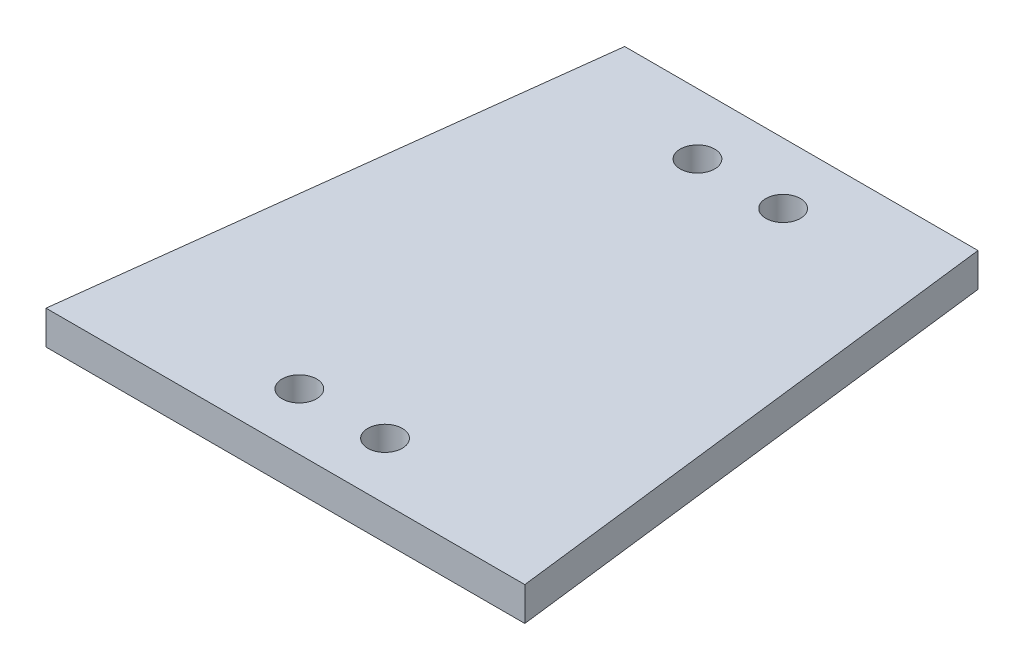
from build123d import *

# Parameters (mm, degrees)
BOSS_EXTRUDE1_DEPTH            = 4
F_4_1_4_1_DIAMETER_HOLE1_D     = 4.1
F_4_1_4_1_DIAMETER_HOLE1_DEPTH = 15


with BuildPart() as part:
    # Sketch1 → Boss-Extrude1 (new body)
    with BuildSketch(Plane(origin=(0, -13.999999791, 0), x_dir=(1, 0, 0), z_dir=(0, 1, 0))):
        Polygon((-28.418499998, 23.757663266), (28.418499998, 23.757663266), (20.970528274, 85.000000013), (-20.970528274, 85.000000013), align=None)
    extrude(amount=-BOSS_EXTRUDE1_DEPTH)

    # Sketch2 → Revolve1 (revolve)
    with BuildSketch(Plane(origin=(0, 0, -64.665000013), x_dir=(-1, 0, 0), z_dir=(0, 0, -1))):
        Polygon((-3, -28.999999791), (0, -28.999999791), (0, -17.999999791), (-5, -17.999999791), (-5, -23.999999791), (-3, -23.999999791), align=None)
    revolve(axis=Axis((0, -28.999999791, -64.665000013), (0, 1, 0)))

    # Ø4.1 (4.1) Diameter Hole1
    with Locations(Plane(origin=(0, -13.999999791, 0), x_dir=(1, 0, 0), z_dir=(0, 1, 0))):
        with Locations((-5.085, 30.495), (5.085, 30.495), (5.085, 77.755), (-5.085, 77.755)):
            Hole(F_4_1_4_1_DIAMETER_HOLE1_D / 2, depth=F_4_1_4_1_DIAMETER_HOLE1_DEPTH)


solid = part.part
